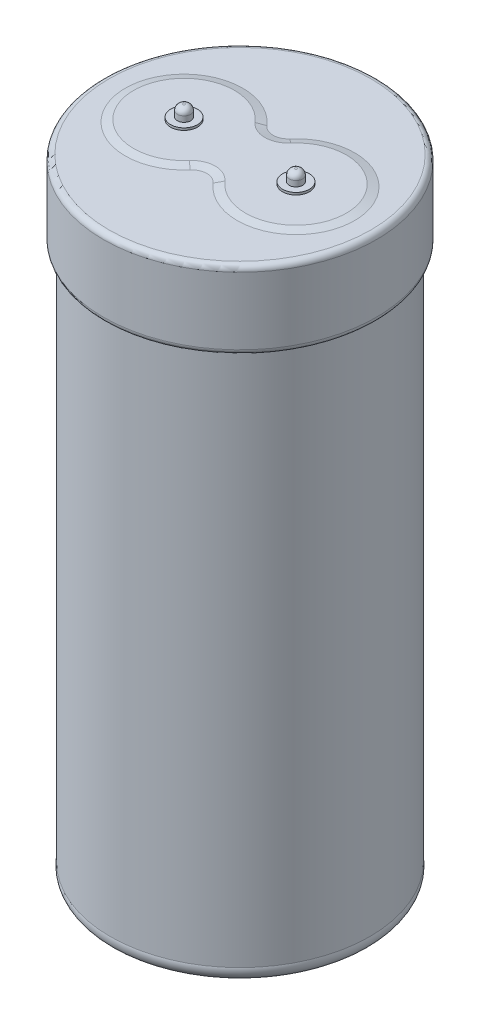
from build123d import *
from OCP.BRepFilletAPI import BRepFilletAPI_MakeChamfer

# Parameters (mm, degrees)
SKETCH2_R           = 6
BOSS_EXTRUDE1_DEPTH = 1
SKETCH3_R           = 6
BOSS_EXTRUDE2_DEPTH = 2
SKETCH4_R           = 3
BOSS_EXTRUDE3_DEPTH = 5
FILLET1_R           = 2.5
FILLET2_R           = 2.5
CHAMFER1_SIZE       = 1
CHAMFER1_SIZE_2     = 3.732050808


with BuildPart() as part:
    # Sketch1 → Revolve1 (revolve)
    with BuildSketch(Plane.XY, mode=Mode.PRIVATE) as revolve1_sk:
        with BuildLine():
            Line((0, 125.42410169), (61, 125.42410169))
            Line((61, 125.42410169), (61, 90.42410169))
            Line((61, 90.42410169), (58, 90.42410169))
            Line((58, 90.42410169), (58, -148.244074886))
            ThreePointArc((58, -148.244074886), (57.09375458, -152.613239536), (53.086404952, -154.57589831))
            Line((53.086404952, -154.57589831), (6, -154.57589831))
            Line((6, -154.57589831), (6, -169.763264473))
            Line((6, -169.763264473), (5.187366163, -170.57589831))
            Line((5.187366163, -170.57589831), (0, -170.57589831))
            Line((0, -170.57589831), (0, 125.42410169))
        make_face()
    revolve(revolve1_sk.sketch.rotate(Axis((0, 125.42410169, 0), (0, -1, 0)), 90), axis=Axis((0, 125.42410169, 0), (0, -1, 0)))

    # Sketch2 → Boss-Extrude1 (add)
    with BuildSketch(Plane(origin=(0, 125.42410169, 0), x_dir=(1, 0, 0), z_dir=(0, 1, 0))):
        with BuildLine():
            ThreePointArc((5.113636364, 17.134615295), (0, 14.790659229), (-5.113636364, 17.134615295))
            ThreePointArc((-5.113636364, 17.134615295), (-51.25, 0), (-5.113636364, -17.134615295))
            ThreePointArc((-5.113636364, -17.134615295), (0, -14.790659229), (5.113636364, -17.134615295))
            ThreePointArc((5.113636364, -17.134615295), (51.25, 0), (5.113636364, 17.134615295))
        make_face()
        with Locations(Location((25, 0, 0), (0, 0, 180))):
            Circle(SKETCH2_R, mode=Mode.SUBTRACT)
        with Locations((-25, 0)):
            Circle(SKETCH2_R, mode=Mode.SUBTRACT)
    extrude(amount=BOSS_EXTRUDE1_DEPTH)

    # Sketch3 → Boss-Extrude2 (add)
    with BuildSketch(Plane(origin=(0, 125.42410169, 0), x_dir=(1, 0, 0), z_dir=(0, 1, 0))):
        with Locations((-25, 0)):
            Circle(SKETCH3_R)
        with Locations(Location((25, 0, 0), (0, 0, 180))):
            Circle(SKETCH3_R)
    extrude(amount=BOSS_EXTRUDE2_DEPTH)

    # Sketch4 → Boss-Extrude3 (add)
    with BuildSketch(Plane(origin=(0, 127.42410169, 0), x_dir=(1, 0, 0), z_dir=(0, 1, 0))):
        with Locations((25, 0)):
            Circle(SKETCH4_R)
        with Locations(Location((-25, 0, 0), (0, 0, 180))):
            Circle(SKETCH4_R)
    extrude(amount=BOSS_EXTRUDE3_DEPTH)

    # Fillet1
    fillet1_edges = [part.edges().sort_by_distance(p)[0] for p in [
        (22, 132.42410169, 0),
        (-22, 132.42410169, 0),
    ]]
    fillet(fillet1_edges, radius=FILLET1_R)

    # Fillet2
    fillet2_edges = [part.edges().sort_by_distance(p)[0] for p in [
        (0, 90.42410169, -61),
        (0, 125.42410169, -61),
    ]]
    fillet(fillet2_edges, radius=FILLET2_R)

    # Chamfer1
    chamfer1_edges_1 = [part.edges().sort_by_distance(p)[0] for p in [
        (51.25, 126.42410169, 0),
    ]]
    chamfer1_side_1 = [part.faces().sort_by_distance(p)[0] for p in [
        (51.25, 126.40410169, 0),
    ]]
    chamfer1_edges_2 = [part.edges().sort_by_distance(p)[0] for p in [
        (0, 126.42410169, -14.790659229),
    ]]
    chamfer1_side_2 = [part.faces().sort_by_distance(p)[0] for p in [
        (0, 126.40410169, -14.790659229),
    ]]
    chamfer1_edges_3 = [part.edges().sort_by_distance(p)[0] for p in [
        (0, 126.42410169, 14.790659229),
    ]]
    chamfer1_side_3 = [part.faces().sort_by_distance(p)[0] for p in [
        (0, 126.40410169, 14.790659229),
    ]]
    chamfer1_edges_4 = [part.edges().sort_by_distance(p)[0] for p in [
        (-51.25, 126.42410169, 0),
    ]]
    chamfer1_side_4 = [part.faces().sort_by_distance(p)[0] for p in [
        (-51.25, 126.40410169, 0),
    ]]
    chamfer1 = BRepFilletAPI_MakeChamfer(part.part.solid().wrapped)
    for e in chamfer1_edges_1:
        chamfer1.Add(CHAMFER1_SIZE - 0.0001, CHAMFER1_SIZE_2 - 0.0001, e.wrapped, chamfer1_side_1[0].wrapped)
    for e in chamfer1_edges_2:
        chamfer1.Add(CHAMFER1_SIZE - 0.0001, CHAMFER1_SIZE_2 - 0.0001, e.wrapped, chamfer1_side_2[0].wrapped)
    for e in chamfer1_edges_3:
        chamfer1.Add(CHAMFER1_SIZE - 0.0001, CHAMFER1_SIZE_2 - 0.0001, e.wrapped, chamfer1_side_3[0].wrapped)
    for e in chamfer1_edges_4:
        chamfer1.Add(CHAMFER1_SIZE - 0.0001, CHAMFER1_SIZE_2 - 0.0001, e.wrapped, chamfer1_side_4[0].wrapped)
    add(Compound.cast(chamfer1.Shape()), mode=Mode.REPLACE)  # a hair under: the kernel refuses the full size


solid = part.part
